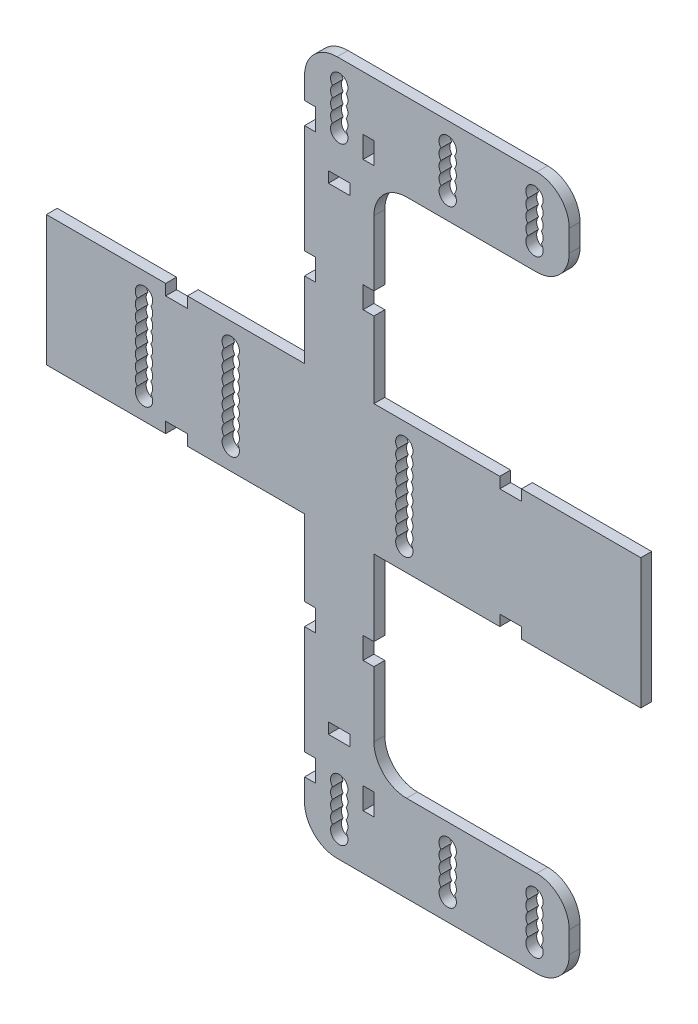
from build123d import *

# Parameters (mm, degrees)
SKETCH1_W           = 60
SKETCH1_H           = 274
BOSS_EXTRUDE2_DEPTH = 2.5
CUT_EXTRUDE1_REACH  = 142.335
SKETCH2_W           = 10
SKETCH2_H           = 5
SKETCH3_W           = 5
SKETCH3_H           = 10
BOSS_EXTRUDE3_DEPTH = 2.5
FILLET5_R           = 15
CUT_EXTRUDE2_REACH  = 212.699
SKETCH4_W           = 5
SKETCH4_H           = 10


with BuildPart() as part:
    # Sketch1 → Boss-Extrude2 (new, symmetric)
    with BuildSketch(Plane(origin=(0, 0, 0), x_dir=(0, 1, 0), z_dir=(0, 0, 1))):
        Rectangle(SKETCH1_W, SKETCH1_H)
        with BuildLine():
            ThreePointArc((-2.5, -24.877501001), (0, -24), (2.5, -24.877501001))
            ThreePointArc((2.5, -24.877501001), (5, -24), (7.5, -24.877501001))
            ThreePointArc((7.5, -24.877501001), (10, -24), (12.5, -24.877501001))
            ThreePointArc((12.5, -24.877501001), (15, -24), (17.5, -24.877501001))
            ThreePointArc((17.5, -24.877501001), (21.732050808, -24.394448725), (24, -28))
            ThreePointArc((24, -28), (21.732050808, -31.605551275), (17.5, -31.122498999))
            ThreePointArc((17.5, -31.122498999), (15, -32), (12.5, -31.122498999))
            ThreePointArc((12.5, -31.122498999), (10, -32), (7.5, -31.122498999))
            ThreePointArc((7.5, -31.122498999), (5, -32), (2.5, -31.122498999))
            ThreePointArc((2.5, -31.122498999), (0, -32), (-2.5, -31.122498999))
            ThreePointArc((-2.5, -31.122498999), (-5, -32), (-7.5, -31.122498999))
            ThreePointArc((-7.5, -31.122498999), (-10, -32), (-12.5, -31.122498999))
            ThreePointArc((-12.5, -31.122498999), (-15, -32), (-17.5, -31.122498999))
            ThreePointArc((-17.5, -31.122498999), (-24, -28), (-17.5, -24.877501001))
            ThreePointArc((-17.5, -24.877501001), (-15, -24), (-12.5, -24.877501001))
            ThreePointArc((-12.5, -24.877501001), (-10, -24), (-7.5, -24.877501001))
            ThreePointArc((-7.5, -24.877501001), (-5, -24), (-2.5, -24.877501001))
        make_face(mode=Mode.SUBTRACT)
        with BuildLine():
            ThreePointArc((-2.5, 55.122498999), (0, 56), (2.5, 55.122498999))
            ThreePointArc((2.5, 55.122498999), (5, 56), (7.5, 55.122498999))
            ThreePointArc((7.5, 55.122498999), (10, 56), (12.5, 55.122498999))
            ThreePointArc((12.5, 55.122498999), (15, 56), (17.5, 55.122498999))
            ThreePointArc((17.5, 55.122498999), (21.732050808, 55.605551275), (24, 52))
            ThreePointArc((24, 52), (21.732050808, 48.394448725), (17.5, 48.877501001))
            ThreePointArc((17.5, 48.877501001), (15, 48), (12.5, 48.877501001))
            ThreePointArc((12.5, 48.877501001), (10, 48), (7.5, 48.877501001))
            ThreePointArc((7.5, 48.877501001), (5, 48), (2.5, 48.877501001))
            ThreePointArc((2.5, 48.877501001), (0, 48), (-2.5, 48.877501001))
            ThreePointArc((-2.5, 48.877501001), (-5, 48), (-7.5, 48.877501001))
            ThreePointArc((-7.5, 48.877501001), (-10, 48), (-12.5, 48.877501001))
            ThreePointArc((-12.5, 48.877501001), (-15, 48), (-17.5, 48.877501001))
            ThreePointArc((-17.5, 48.877501001), (-24, 52), (-17.5, 55.122498999))
            ThreePointArc((-17.5, 55.122498999), (-15, 56), (-12.5, 55.122498999))
            ThreePointArc((-12.5, 55.122498999), (-10, 56), (-7.5, 55.122498999))
            ThreePointArc((-7.5, 55.122498999), (-5, 56), (-2.5, 55.122498999))
        make_face(mode=Mode.SUBTRACT)
        with BuildLine():
            ThreePointArc((-2.5, 95.122498999), (0, 96), (2.5, 95.122498999))
            ThreePointArc((2.5, 95.122498999), (5, 96), (7.5, 95.122498999))
            ThreePointArc((7.5, 95.122498999), (10, 96), (12.5, 95.122498999))
            ThreePointArc((12.5, 95.122498999), (15, 96), (17.5, 95.122498999))
            ThreePointArc((17.5, 95.122498999), (21.732050808, 95.605551275), (24, 92))
            ThreePointArc((24, 92), (21.732050808, 88.394448725), (17.5, 88.877501001))
            ThreePointArc((17.5, 88.877501001), (15, 88), (12.5, 88.877501001))
            ThreePointArc((12.5, 88.877501001), (10, 88), (7.5, 88.877501001))
            ThreePointArc((7.5, 88.877501001), (5, 88), (2.5, 88.877501001))
            ThreePointArc((2.5, 88.877501001), (0, 88), (-2.5, 88.877501001))
            ThreePointArc((-2.5, 88.877501001), (-5, 88), (-7.5, 88.877501001))
            ThreePointArc((-7.5, 88.877501001), (-10, 88), (-12.5, 88.877501001))
            ThreePointArc((-12.5, 88.877501001), (-15, 88), (-17.5, 88.877501001))
            ThreePointArc((-17.5, 88.877501001), (-24, 92), (-17.5, 95.122498999))
            ThreePointArc((-17.5, 95.122498999), (-15, 96), (-12.5, 95.122498999))
            ThreePointArc((-12.5, 95.122498999), (-10, 96), (-7.5, 95.122498999))
            ThreePointArc((-7.5, 95.122498999), (-5, 96), (-2.5, 95.122498999))
        make_face(mode=Mode.SUBTRACT)
    extrude(amount=BOSS_EXTRUDE2_DEPTH, both=True)

    # Sketch2 → Cut-Extrude1 (cut, up to next)
    with BuildSketch(Plane.XY.offset(2.5), mode=Mode.PRIVATE) as cut_extrude1_sk1:
        with Locations((-77, 27.5)):
            Rectangle(SKETCH2_W, SKETCH2_H)
    cut_extrude1_tool1 = extrude(cut_extrude1_sk1.sketch, amount=-CUT_EXTRUDE1_REACH, mode=Mode.PRIVATE) & part.part
    # Sketch2 → Cut-Extrude1 (cut, up to next)
    with BuildSketch(Plane.XY.offset(2.5), mode=Mode.PRIVATE) as cut_extrude1_sk2:
        with Locations((77, 27.5)):
            Rectangle(SKETCH2_W, SKETCH2_H)
    cut_extrude1_tool2 = extrude(cut_extrude1_sk2.sketch, amount=-CUT_EXTRUDE1_REACH, mode=Mode.PRIVATE) & part.part
    cut_extrude1_1 = cut_extrude1_tool1.solids().sort_by_distance((-77, 27.5, 2.5))[0]
    add(cut_extrude1_1, mode=Mode.SUBTRACT)
    cut_extrude1_2 = cut_extrude1_tool2.solids().sort_by_distance((77, 27.5, 2.5))[0]
    add(cut_extrude1_2, mode=Mode.SUBTRACT)
    cut_extrude1 = cut_extrude1_1 + cut_extrude1_2  # Cut-Extrude1 as one shape, for the pattern or mirror that repeats it

    # Mirror1: Cut-Extrude1 across plane
    add(cut_extrude1.mirror(Plane.ZX), mode=Mode.SUBTRACT)


with BuildPart() as body_2:
    # Sketch3 → Boss-Extrude3 (new, symmetric)
    with BuildSketch(Plane(origin=(0, 0, 0), x_dir=(0, 1, 0), z_dir=(0, 0, 1))):
        Polygon((160, 18), (30, 18), (30, -14), (120, -14), (120, -104), (160, -104), (160, -14), align=None)
        with BuildLine():
            ThreePointArc((137.5, -84.877501001), (140, -84), (142.5, -84.877501001))
            ThreePointArc((142.5, -84.877501001), (145, -84), (147.5, -84.877501001))
            ThreePointArc((147.5, -84.877501001), (151.732050808, -84.394448725), (154, -88))
            ThreePointArc((154, -88), (151.732050808, -91.605551275), (147.5, -91.122498999))
            ThreePointArc((147.5, -91.122498999), (145, -92), (142.5, -91.122498999))
            ThreePointArc((142.5, -91.122498999), (140, -92), (137.5, -91.122498999))
            ThreePointArc((137.5, -91.122498999), (135, -92), (132.5, -91.122498999))
            ThreePointArc((132.5, -91.122498999), (126, -88), (132.5, -84.877501001))
            ThreePointArc((132.5, -84.877501001), (135, -84), (137.5, -84.877501001))
        make_face(mode=Mode.SUBTRACT)
        with BuildLine():
            ThreePointArc((137.5, -44.877501001), (140, -44), (142.5, -44.877501001))
            ThreePointArc((142.5, -44.877501001), (145, -44), (147.5, -44.877501001))
            ThreePointArc((147.5, -44.877501001), (151.732050808, -44.394448725), (154, -48))
            ThreePointArc((154, -48), (151.732050808, -51.605551275), (147.5, -51.122498999))
            ThreePointArc((147.5, -51.122498999), (145, -52), (142.5, -51.122498999))
            ThreePointArc((142.5, -51.122498999), (140, -52), (137.5, -51.122498999))
            ThreePointArc((137.5, -51.122498999), (135, -52), (132.5, -51.122498999))
            ThreePointArc((132.5, -51.122498999), (126, -48), (132.5, -44.877501001))
            ThreePointArc((132.5, -44.877501001), (135, -44), (137.5, -44.877501001))
        make_face(mode=Mode.SUBTRACT)
        with Locations((110, 2)):
            Rectangle(SKETCH3_W, SKETCH3_H, mode=Mode.SUBTRACT)
        with BuildLine():
            ThreePointArc((137.5, 5.122498999), (140, 6), (142.5, 5.122498999))
            ThreePointArc((142.5, 5.122498999), (145, 6), (147.5, 5.122498999))
            ThreePointArc((147.5, 5.122498999), (151.732050808, 5.605551275), (154, 2))
            ThreePointArc((154, 2), (151.732050808, -1.605551275), (147.5, -1.122498999))
            ThreePointArc((147.5, -1.122498999), (145, -2), (142.5, -1.122498999))
            ThreePointArc((142.5, -1.122498999), (140, -2), (137.5, -1.122498999))
            ThreePointArc((137.5, -1.122498999), (135, -2), (132.5, -1.122498999))
            ThreePointArc((132.5, -1.122498999), (126, 2), (132.5, 5.122498999))
            ThreePointArc((132.5, 5.122498999), (135, 6), (137.5, 5.122498999))
        make_face(mode=Mode.SUBTRACT)
    extrude(amount=BOSS_EXTRUDE3_DEPTH, both=True)

    # Fillet5
    fillet5_edges = [body_2.edges().sort_by_distance(p)[0] for p in [
        (-18, 160, 0),
        (104, 160, 0),
        (104, 120, 0),
        (14, 120, 0),
    ]]
    fillet(fillet5_edges, radius=FILLET5_R)


with BuildPart() as body_3:
    # Mirror4: mirrored copy
    add(body_2.part.mirror(Plane.ZX))


with BuildPart() as part_1:
    add(part.part)

    # Intersect1: read off the stored shape, not the designer's step
    # Intersect1: union body 3, body 2
    add(body_3.part)
    add(body_2.part)

    # Sketch4 → Cut-Extrude2 (cut, up to next)
    with BuildSketch(Plane.XY.offset(2.5), mode=Mode.PRIVATE) as cut_extrude2_sk1:
        with Locations((11.5, 70)):
            Rectangle(SKETCH4_W, SKETCH4_H)
    cut_extrude2_tool1 = extrude(cut_extrude2_sk1.sketch, amount=-CUT_EXTRUDE2_REACH, mode=Mode.PRIVATE) & part_1.part
    # Sketch4 → Cut-Extrude2 (cut, up to next)
    with BuildSketch(Plane.XY.offset(2.5), mode=Mode.PRIVATE) as cut_extrude2_sk2:
        with Locations((11.5, 130)):
            Rectangle(SKETCH4_W, SKETCH4_H)
    cut_extrude2_tool2 = extrude(cut_extrude2_sk2.sketch, amount=-CUT_EXTRUDE2_REACH, mode=Mode.PRIVATE) & part_1.part
    # Sketch4 → Cut-Extrude2 (cut, up to next)
    with BuildSketch(Plane.XY.offset(2.5), mode=Mode.PRIVATE) as cut_extrude2_sk3:
        with Locations((-15.5, 70)):
            Rectangle(SKETCH4_W, SKETCH4_H)
    cut_extrude2_tool3 = extrude(cut_extrude2_sk3.sketch, amount=-CUT_EXTRUDE2_REACH, mode=Mode.PRIVATE) & part_1.part
    # Sketch4 → Cut-Extrude2 (cut, up to next)
    with BuildSketch(Plane.XY.offset(2.5), mode=Mode.PRIVATE) as cut_extrude2_sk4:
        with Locations((-15.5, 130)):
            Rectangle(SKETCH4_W, SKETCH4_H)
    cut_extrude2_tool4 = extrude(cut_extrude2_sk4.sketch, amount=-CUT_EXTRUDE2_REACH, mode=Mode.PRIVATE) & part_1.part
    # Sketch4 → Cut-Extrude2 (cut, up to next)
    with BuildSketch(Plane.XY.offset(2.5), mode=Mode.PRIVATE) as cut_extrude2_sk5:
        with Locations((-15.5, -70)):
            Rectangle(SKETCH4_W, SKETCH4_H)
    cut_extrude2_tool5 = extrude(cut_extrude2_sk5.sketch, amount=-CUT_EXTRUDE2_REACH, mode=Mode.PRIVATE) & part_1.part
    # Sketch4 → Cut-Extrude2 (cut, up to next)
    with BuildSketch(Plane.XY.offset(2.5), mode=Mode.PRIVATE) as cut_extrude2_sk6:
        with Locations((11.5, -130)):
            Rectangle(SKETCH4_W, SKETCH4_H)
    cut_extrude2_tool6 = extrude(cut_extrude2_sk6.sketch, amount=-CUT_EXTRUDE2_REACH, mode=Mode.PRIVATE) & part_1.part
    # Sketch4 → Cut-Extrude2 (cut, up to next)
    with BuildSketch(Plane.XY.offset(2.5), mode=Mode.PRIVATE) as cut_extrude2_sk7:
        with Locations((-15.5, -130)):
            Rectangle(SKETCH4_W, SKETCH4_H)
    cut_extrude2_tool7 = extrude(cut_extrude2_sk7.sketch, amount=-CUT_EXTRUDE2_REACH, mode=Mode.PRIVATE) & part_1.part
    # Sketch4 → Cut-Extrude2 (cut, up to next)
    with BuildSketch(Plane.XY.offset(2.5), mode=Mode.PRIVATE) as cut_extrude2_sk8:
        with Locations((11.5, -70)):
            Rectangle(SKETCH4_W, SKETCH4_H)
    cut_extrude2_tool8 = extrude(cut_extrude2_sk8.sketch, amount=-CUT_EXTRUDE2_REACH, mode=Mode.PRIVATE) & part_1.part
    add(cut_extrude2_tool1.solids().sort_by_distance((11.5, 70, 2.5))[0], mode=Mode.SUBTRACT)
    add(cut_extrude2_tool2.solids().sort_by_distance((11.5, 130, 2.5))[0], mode=Mode.SUBTRACT)
    add(cut_extrude2_tool3.solids().sort_by_distance((-15.5, 70, 2.5))[0], mode=Mode.SUBTRACT)
    add(cut_extrude2_tool4.solids().sort_by_distance((-15.5, 130, 2.5))[0], mode=Mode.SUBTRACT)
    add(cut_extrude2_tool5.solids().sort_by_distance((-15.5, -70, 2.5))[0], mode=Mode.SUBTRACT)
    add(cut_extrude2_tool6.solids().sort_by_distance((11.5, -130, 2.5))[0], mode=Mode.SUBTRACT)
    add(cut_extrude2_tool7.solids().sort_by_distance((-15.5, -130, 2.5))[0], mode=Mode.SUBTRACT)
    add(cut_extrude2_tool8.solids().sort_by_distance((11.5, -70, 2.5))[0], mode=Mode.SUBTRACT)


solid = part_1.part
